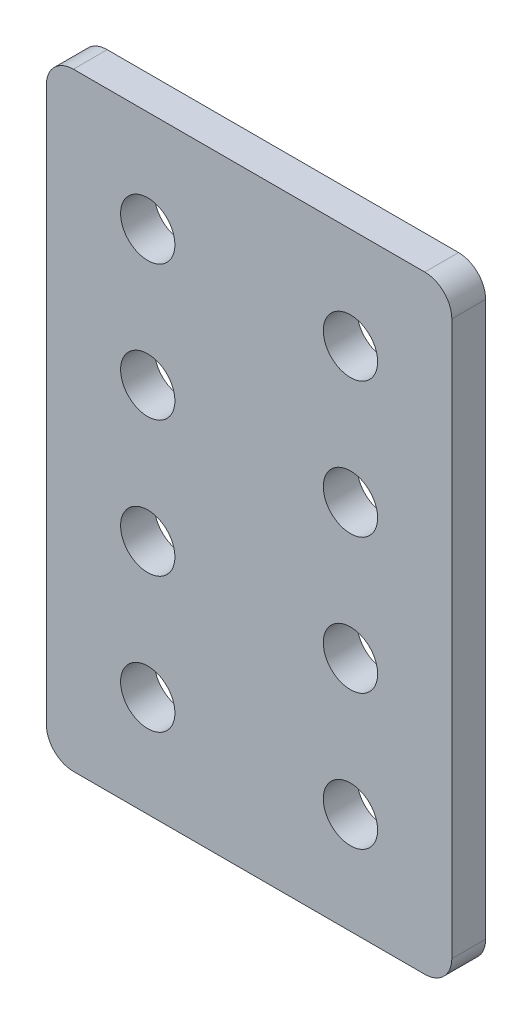
from build123d import *

# Parameters (mm, degrees)
SKETCH1_W           = 38.1
SKETCH1_H           = 57.15
SKETCH1_R           = 2.5527
BOSS_EXTRUDE1_DEPTH = 3.175
FILLET1_R           = 2.54


with BuildPart() as part:
    # Sketch1 → Boss-Extrude1 (new body)
    with BuildSketch(Plane.XY):
        Rectangle(SKETCH1_W, SKETCH1_H)
        with Locations((-9.525, -19.05)):
            Circle(SKETCH1_R, mode=Mode.SUBTRACT)
        with Locations((-9.525, -6.35)):
            Circle(SKETCH1_R, mode=Mode.SUBTRACT)
        with Locations((-9.525, 6.35)):
            Circle(SKETCH1_R, mode=Mode.SUBTRACT)
        with Locations((-9.525, 19.05)):
            Circle(SKETCH1_R, mode=Mode.SUBTRACT)
        with Locations((9.525, -19.05)):
            Circle(SKETCH1_R, mode=Mode.SUBTRACT)
        with Locations((9.525, -6.35)):
            Circle(SKETCH1_R, mode=Mode.SUBTRACT)
        with Locations((9.525, 6.35)):
            Circle(SKETCH1_R, mode=Mode.SUBTRACT)
        with Locations((9.525, 19.05)):
            Circle(SKETCH1_R, mode=Mode.SUBTRACT)
    extrude(amount=BOSS_EXTRUDE1_DEPTH)

    # Fillet1
    fillet1_edges = [part.edges().sort_by_distance(p)[0] for p in [
        (-19.05, 28.575, 1.5875),
        (-19.05, -28.575, 1.5875),
        (19.05, -28.575, 1.5875),
        (19.05, 28.575, 1.5875),
    ]]
    fillet(fillet1_edges, radius=FILLET1_R)


solid = part.part
